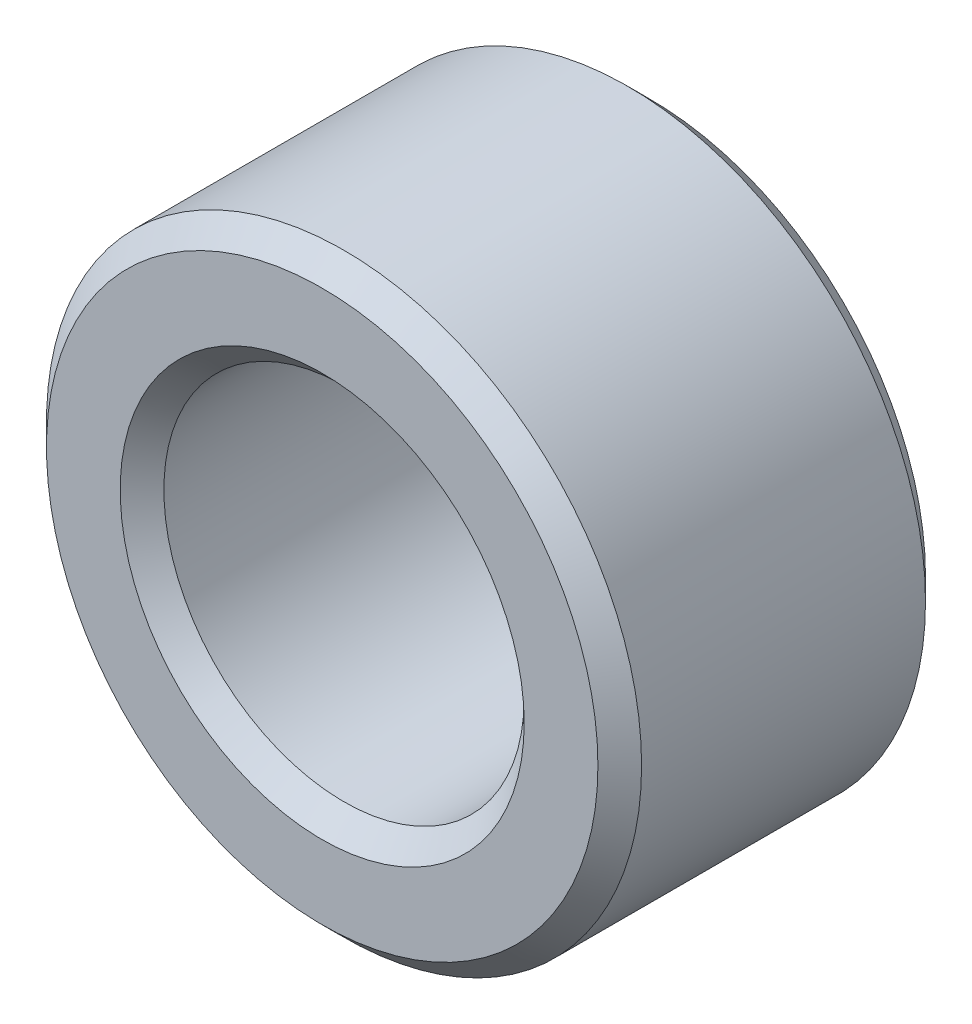
from build123d import *

# Parameters (mm, degrees)
SKETCH1_R           = 2.725
SKETCH1_R_2         = 1.65
BOSS_EXTRUDE1_DEPTH = 3
DEBURS_SIZE         = 0.2


with BuildPart() as part:
    # Sketch1 → Boss-Extrude1 (new body)
    with BuildSketch(Plane.XY):
        Circle(SKETCH1_R)
        Circle(SKETCH1_R_2, mode=Mode.SUBTRACT)
    extrude(amount=BOSS_EXTRUDE1_DEPTH)

    # Deburs
    deburs_edges = [part.edges().sort_by_distance(p)[0] for p in [
        (-1.65, 0, 0),
        (-1.65, 0, 3),
        (-2.725, 0, 0),
        (-2.725, 0, 3),
    ]]
    chamfer(deburs_edges, length=DEBURS_SIZE)


solid = part.part
